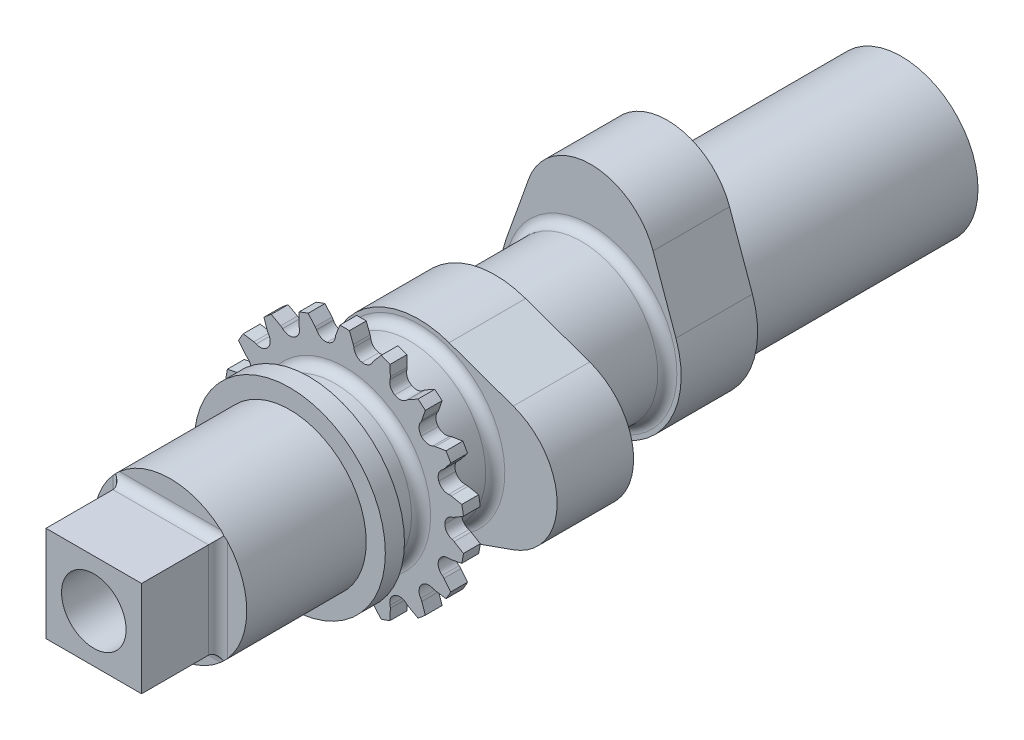
from build123d import *

# Parameters (mm, degrees)
BOSS_EXTRUDE2_DEPTH         = 12.7
BOSS_EXTRUDE3_DEPTH         = 69.85
BOSS_EXTRUDE3_DEPTH_BACK    = 51.59375
SKETCH3_R                   = 12.7
CRVPATTERN3_START           = 28.575
CRVPATTERN3_OUTLINE_R       = 12.7
CRVPATTERN3_DEPTH           = 12.7
BOSS_EXTRUDE5_START         = -31.75
BOSS_EXTRUDE5_DEPTH         = 2.794
BOSS_EXTRUDE7_START         = -19.84375
SKETCH10_R                  = 15.875
BOSS_EXTRUDE7_DEPTH         = 3.175
SKETCH9_W                   = 15.875
SKETCH9_H                   = 15.875
BOSS_EXTRUDE8_DEPTH         = 12.7
FILLET1_R                   = 1.5875
F_1_2_13_TAPPED_HOLE1_D     = 10.71626
F_1_2_13_TAPPED_HOLE1_DEPTH = 25.4
F_1_2_13_TAPPED_HOLE1_TIP   = 3.219489309


# Read off the part's stored shape, not the designer's step: CrvPattern3
with BuildPart() as part:
    # Sketch2 → Boss-Extrude2 (new body)
    with BuildSketch(Plane.XY):
        with BuildLine():
            Line((14.12854649, 5.034399247), (10.332705095, 15.687054901))
            ThreePointArc((10.332705095, 15.687054901), (0, 22.9743), (-10.332705095, 15.687054901))
            Line((-10.332705095, 15.687054901), (-14.12854649, 5.034399247))
            ThreePointArc((-14.12854649, 5.034399247), (0, -14.9987), (14.12854649, 5.034399247))
        make_face()
    extrude(amount=BOSS_EXTRUDE2_DEPTH)

    # Sketch3 → Boss-Extrude3 (add, two sides: drawn at the far end of the back side and taken through both)
    with BuildSketch(Plane.XY.offset(12.7).offset(-BOSS_EXTRUDE3_DEPTH_BACK)):
        Circle(SKETCH3_R)
    extrude(amount=BOSS_EXTRUDE3_DEPTH + BOSS_EXTRUDE3_DEPTH_BACK)

    # CrvPattern3 outline → CrvPattern3 (add)
    with BuildSketch(Plane.XY.offset(CRVPATTERN3_START)):
        with BuildLine():
            ThreePointArc((5.034399247, 14.12854649), (-14.9987, 0), (5.034399247, -14.12854649))
            Line((5.034399247, -14.12854649), (15.687054901, -10.332705095))
            ThreePointArc((15.687054901, -10.332705095), (22.9743, 0), (15.687054901, 10.332705095))
            Line((15.687054901, 10.332705095), (5.034399247, 14.12854649))
        make_face()
        Circle(CRVPATTERN3_OUTLINE_R, mode=Mode.SUBTRACT)
    extrude(amount=CRVPATTERN3_DEPTH)

    # Sketch7 → Boss-Extrude5 (add)
    with BuildSketch(Plane.XY.offset(82.55).offset(BOSS_EXTRUDE5_START)):
        with BuildLine():
            Line((-0.79375, 19.897774396), (-1.436590898, 18.231487888))
            ThreePointArc((-1.436590898, 18.231487888), (-1.498138247, 18.03477884), (-1.533681014, 17.831753627))
            ThreePointArc((-1.533681014, 17.831753627), (-1.969599997, 16.882094075), (-2.888368056, 16.384355312))
            ThreePointArc((-2.888368056, 16.384355312), (-3.922431543, 16.537748425), (-4.657630199, 17.280917099))
            ThreePointArc((-4.657630199, 17.280917099), (-4.760468189, 17.459542051), (-4.885582235, 17.623337659))
            Line((-4.885582235, 17.623337659), (-6.059558633, 18.969270258))
            ThreePointArc((-6.059558633, 18.969270258), (-6.810852326, 18.712662973), (-7.551320668, 18.426313281))
            Line((-7.551320668, 18.426313281), (-7.585489966, 16.640651609))
            ThreePointArc((-7.585489966, 16.640651609), (-7.576047099, 16.434755136), (-7.540007663, 16.231817498))
            ThreePointArc((-7.540007663, 16.231817498), (-7.624834818, 15.190336353), (-8.3179577, 14.408377726))
            ThreePointArc((-8.3179577, 14.408377726), (-9.342178022, 14.198393618), (-10.287162472, 14.64574693))
            ThreePointArc((-10.287162472, 14.64574693), (-10.444891903, 14.778426816), (-10.618482046, 14.889552815))
            Line((-10.618482046, 14.889552815), (-12.181995065, 15.752792171))
            ThreePointArc((-12.181995065, 15.752792171), (-12.800215344, 15.254702622), (-13.398090619, 14.732366841))
            Line((-13.398090619, 14.732366841), (-12.819466994, 13.042707157))
            ThreePointArc((-12.819466994, 13.042707157), (-12.74017286, 12.852457411), (-12.636898109, 12.674084624))
            ThreePointArc((-12.636898109, 12.674084624), (-12.36040203, 11.666399881), (-12.744278886, 10.694537142))
            ThreePointArc((-12.744278886, 10.694537142), (-13.63491237, 10.146912643), (-14.675911128, 10.244083533))
            ThreePointArc((-14.675911128, 10.244083533), (-14.869507504, 10.3148152), (-15.070636211, 10.359868156))
            Line((-15.070636211, 10.359868156), (-16.835103105, 10.636294862))
            ThreePointArc((-16.835103105, 10.636294862), (-17.245683481, 9.9568), (-17.628853105, 9.261479534))
            Line((-17.628853105, 9.261479534), (-16.507227108, 7.871619731))
            ThreePointArc((-16.507227108, 7.871619731), (-16.36764575, 7.71996364), (-16.209592142, 7.587670094))
            ThreePointArc((-16.209592142, 7.587670094), (-15.605122337, 6.735323405), (-15.633451952, 5.690777544))
            ThreePointArc((-15.633451952, 5.690777544), (-16.283326029, 4.871948852), (-17.294528308, 4.606832476))
            ThreePointArc((-17.294528308, 4.606832476), (-17.500641049, 4.60708464), (-17.705049229, 4.580630502))
            Line((-17.705049229, 4.580630502), (-19.457649251, 4.236903417))
            ThreePointArc((-19.457649251, 4.236903417), (-19.61106767, 3.457960351), (-19.733315733, 2.673521109))
            Line((-19.733315733, 2.673521109), (-18.203972012, 1.751098794))
            ThreePointArc((-18.203972012, 1.751098794), (-18.020939002, 1.65632832), (-17.827170135, 1.586070568))
            ThreePointArc((-17.827170135, 1.586070568), (-16.967634583, 0.991867524), (-16.636999988, 0.000626187))
            ThreePointArc((-16.636999988, 0.000626187), (-16.967258577, -0.991366685), (-17.827170135, -1.586070568))
            ThreePointArc((-17.827170135, -1.586070568), (-18.020939002, -1.65632832), (-18.203972012, -1.751098794))
            Line((-18.203972012, -1.751098794), (-19.733315733, -2.673521109))
            ThreePointArc((-19.733315733, -2.673521109), (-19.61106767, -3.457960351), (-19.457649251, -4.236903417))
            Line((-19.457649251, -4.236903417), (-17.705049229, -4.580630502))
            ThreePointArc((-17.705049229, -4.580630502), (-17.500641049, -4.60708464), (-17.294528308, -4.606832476))
            ThreePointArc((-17.294528308, -4.606832476), (-16.283599682, -4.871222219), (-15.63388029, -5.689600697))
            ThreePointArc((-15.63388029, -5.689600697), (-15.605379777, -6.734590871), (-16.209592142, -7.587670094))
            ThreePointArc((-16.209592142, -7.587670094), (-16.36764575, -7.71996364), (-16.507227108, -7.871619731))
            Line((-16.507227108, -7.871619731), (-17.628853105, -9.261479534))
            ThreePointArc((-17.628853105, -9.261479534), (-17.245683481, -9.9568), (-16.835103105, -10.636294862))
            Line((-16.835103105, -10.636294862), (-15.070636211, -10.359868156))
            ThreePointArc((-15.070636211, -10.359868156), (-14.869507504, -10.3148152), (-14.675911128, -10.244083533))
            ThreePointArc((-14.675911128, -10.244083533), (-13.63552234, -10.14677067), (-12.745083897, -10.693577767))
            ThreePointArc((-12.745083897, -10.693577767), (-12.360894486, -11.665799573), (-12.636898109, -12.674084624))
            ThreePointArc((-12.636898109, -12.674084624), (-12.74017286, -12.852457411), (-12.819466994, -13.042707157))
            Line((-12.819466994, -13.042707157), (-13.398090619, -14.732366841))
            ThreePointArc((-13.398090619, -14.732366841), (-12.800215344, -15.254702622), (-12.181995065, -15.752792171))
            Line((-12.181995065, -15.752792171), (-10.618482046, -14.889552815))
            ThreePointArc((-10.618482046, -14.889552815), (-10.444891903, -14.778426816), (-10.287162472, -14.64574693))
            ThreePointArc((-10.287162472, -14.64574693), (-9.342799764, -14.198468829), (-8.319042288, -14.407751539))
            ThreePointArc((-8.319042288, -14.407751539), (-7.625502893, -15.189940678), (-7.540007663, -16.231817498))
            ThreePointArc((-7.540007663, -16.231817498), (-7.576047099, -16.434755136), (-7.585489966, -16.640651609))
            Line((-7.585489966, -16.640651609), (-7.551320668, -18.426313281))
            ThreePointArc((-7.551320668, -18.426313281), (-6.810852326, -18.712662973), (-6.059558633, -18.969270258))
            Line((-6.059558633, -18.969270258), (-4.885582235, -17.623337659))
            ThreePointArc((-4.885582235, -17.623337659), (-4.760468189, -17.459542051), (-4.657630199, -17.280917099))
            ThreePointArc((-4.657630199, -17.280917099), (-3.923197652, -16.537622099), (-2.889601404, -16.384137839))
            ThreePointArc((-2.889601404, -16.384137839), (-1.970363111, -16.881950758), (-1.533681014, -17.831753627))
            ThreePointArc((-1.533681014, -17.831753627), (-1.498138247, -18.03477884), (-1.436590898, -18.231487888))
            Line((-1.436590898, -18.231487888), (-0.79375, -19.897774396))
            ThreePointArc((-0.79375, -19.897774396), (0, -19.9136), (0.79375, -19.897774396))
            Line((0.79375, -19.897774396), (1.436590898, -18.231487888))
            ThreePointArc((1.436590898, -18.231487888), (1.498138247, -18.03477884), (1.533681014, -17.831753627))
            ThreePointArc((1.533681014, -17.831753627), (1.969599997, -16.882094075), (2.888368056, -16.384355312))
            ThreePointArc((2.888368056, -16.384355312), (3.922431543, -16.537748425), (4.657630199, -17.280917099))
            ThreePointArc((4.657630199, -17.280917099), (4.760468189, -17.459542051), (4.885582235, -17.623337659))
            Line((4.885582235, -17.623337659), (6.059558633, -18.969270258))
            ThreePointArc((6.059558633, -18.969270258), (6.810852326, -18.712662973), (7.551320668, -18.426313281))
            Line((7.551320668, -18.426313281), (7.585489966, -16.640651609))
            ThreePointArc((7.585489966, -16.640651609), (7.576047099, -16.434755136), (7.540007663, -16.231817498))
            ThreePointArc((7.540007663, -16.231817498), (7.624834818, -15.190336353), (8.3179577, -14.408377726))
            ThreePointArc((8.3179577, -14.408377726), (9.342123063, -14.198849561), (10.287162472, -14.64574693))
            ThreePointArc((10.287162472, -14.64574693), (10.444891903, -14.778426816), (10.618482046, -14.889552815))
            Line((10.618482046, -14.889552815), (12.181995065, -15.752792171))
            ThreePointArc((12.181995065, -15.752792171), (12.800215344, -15.254702622), (13.398090619, -14.732366841))
            Line((13.398090619, -14.732366841), (12.819466994, -13.042707157))
            ThreePointArc((12.819466994, -13.042707157), (12.74017286, -12.852457411), (12.636898109, -12.674084624))
            ThreePointArc((12.636898109, -12.674084624), (12.36040203, -11.666399881), (12.744278886, -10.694537142))
            ThreePointArc((12.744278886, -10.694537142), (13.63491237, -10.146912643), (14.675911128, -10.244083533))
            ThreePointArc((14.675911128, -10.244083533), (14.869507504, -10.3148152), (15.070636211, -10.359868156))
            Line((15.070636211, -10.359868156), (16.835103105, -10.636294862))
            ThreePointArc((16.835103105, -10.636294862), (17.245683481, -9.9568), (17.628853105, -9.261479534))
            Line((17.628853105, -9.261479534), (16.507227108, -7.871619731))
            ThreePointArc((16.507227108, -7.871619731), (16.36764575, -7.71996364), (16.209592142, -7.587670094))
            ThreePointArc((16.209592142, -7.587670094), (15.605122337, -6.735323405), (15.633451952, -5.690777544))
            ThreePointArc((15.633451952, -5.690777544), (16.283075056, -4.871564252), (17.294528308, -4.606832476))
            ThreePointArc((17.294528308, -4.606832476), (17.500641049, -4.60708464), (17.705049229, -4.580630502))
            Line((17.705049229, -4.580630502), (19.457649251, -4.236903417))
            ThreePointArc((19.457649251, -4.236903417), (19.61106767, -3.457960351), (19.733315733, -2.673521109))
            Line((19.733315733, -2.673521109), (18.203972012, -1.751098794))
            ThreePointArc((18.203972012, -1.751098794), (18.020939002, -1.65632832), (17.827170135, -1.586070568))
            ThreePointArc((17.827170135, -1.586070568), (16.967634583, -0.991867524), (16.636999988, -0.000626187))
            ThreePointArc((16.636999988, -0.000626187), (16.967625956, 0.991091117), (17.827170135, 1.586070568))
            ThreePointArc((17.827170135, 1.586070568), (18.020939002, 1.65632832), (18.203972012, 1.751098794))
            Line((18.203972012, 1.751098794), (19.733315733, 2.673521109))
            ThreePointArc((19.733315733, 2.673521109), (19.61106767, 3.457960351), (19.457649251, 4.236903417))
            Line((19.457649251, 4.236903417), (17.705049229, 4.580630502))
            ThreePointArc((17.705049229, 4.580630502), (17.500641049, 4.60708464), (17.294528308, 4.606832476))
            ThreePointArc((17.294528308, 4.606832476), (16.283599682, 4.871222219), (15.63388029, 5.689600697))
            ThreePointArc((15.63388029, 5.689600697), (15.604940304, 6.734724169), (16.209592142, 7.587670094))
            ThreePointArc((16.209592142, 7.587670094), (16.36764575, 7.71996364), (16.507227108, 7.871619731))
            Line((16.507227108, 7.871619731), (17.628853105, 9.261479534))
            ThreePointArc((17.628853105, 9.261479534), (17.245683481, 9.9568), (16.835103105, 10.636294862))
            Line((16.835103105, 10.636294862), (15.070636211, 10.359868156))
            ThreePointArc((15.070636211, 10.359868156), (14.869507504, 10.3148152), (14.675911128, 10.244083533))
            ThreePointArc((14.675911128, 10.244083533), (13.63552234, 10.14677067), (12.745083897, 10.693577767))
            ThreePointArc((12.745083897, 10.693577767), (12.360435926, 11.665774524), (12.636898109, 12.674084624))
            ThreePointArc((12.636898109, 12.674084624), (12.74017286, 12.852457411), (12.819466994, 13.042707157))
            Line((12.819466994, 13.042707157), (13.398090619, 14.732366841))
            ThreePointArc((13.398090619, 14.732366841), (12.800215344, 15.254702622), (12.181995065, 15.752792171))
            Line((12.181995065, 15.752792171), (10.618482046, 14.889552815))
            ThreePointArc((10.618482046, 14.889552815), (10.444891903, 14.778426816), (10.287162472, 14.64574693))
            ThreePointArc((10.287162472, 14.64574693), (9.342799764, 14.198468829), (8.319042288, 14.407751539))
            ThreePointArc((8.319042288, 14.407751539), (7.625080555, 15.189760303), (7.540007663, 16.231817498))
            ThreePointArc((7.540007663, 16.231817498), (7.576047099, 16.434755136), (7.585489966, 16.640651609))
            Line((7.585489966, 16.640651609), (7.551320668, 18.426313281))
            ThreePointArc((7.551320668, 18.426313281), (6.810852326, 18.712662973), (6.059558633, 18.969270258))
            Line((6.059558633, 18.969270258), (4.885582235, 17.623337659))
            ThreePointArc((4.885582235, 17.623337659), (4.760468189, 17.459542051), (4.657630199, 17.280917099))
            ThreePointArc((4.657630199, 17.280917099), (3.923197652, 16.537622099), (2.889601404, 16.384137839))
            ThreePointArc((2.889601404, 16.384137839), (1.970027934, 16.881636812), (1.533681014, 17.831753627))
            ThreePointArc((1.533681014, 17.831753627), (1.498138247, 18.03477884), (1.436590898, 18.231487888))
            Line((1.436590898, 18.231487888), (0.79375, 19.897774396))
            ThreePointArc((0.79375, 19.897774396), (0, 19.9136), (-0.79375, 19.897774396))
        make_face()
    extrude(amount=BOSS_EXTRUDE5_DEPTH)

    # Sketch10 → Boss-Extrude7 (add)
    with BuildSketch(Plane.XY.offset(82.55).offset(BOSS_EXTRUDE7_START)):
        Circle(SKETCH10_R)
    extrude(amount=-BOSS_EXTRUDE7_DEPTH)

    # Sketch9 → Boss-Extrude8 (add)
    with BuildSketch(Plane.XY.offset(82.55)):
        Rectangle(SKETCH9_W, SKETCH9_H)
    extrude(amount=BOSS_EXTRUDE8_DEPTH)

    # Fillet1
    # the kernel refuses this fillet: 1.5875 mm, written as the material it adds along each edge
    with BuildSketch(Plane(origin=(0, 0, 0), x_dir=(1, 0, 0), z_dir=(0, -1, 0))) as fillet1_piece_1:
        with BuildLine():
            CenterArc((12.7 + FILLET1_R, -FILLET1_R), FILLET1_R, 90, 90)
            Line((12.7, -FILLET1_R), (12.7, 0))
            Line((12.7, 0), (12.7 + FILLET1_R, 0))
        make_face()
    revolve(axis=Axis((0, 0, 0), (0, 0, 1)))
    with BuildSketch(Plane(origin=(0, 0, 12.7), x_dir=(1, 0, 0), z_dir=(0, -1, 0))) as fillet1_piece_2:
        with BuildLine():
            CenterArc((12.7 + FILLET1_R, FILLET1_R), FILLET1_R, 180, 90)
            Line((12.7, FILLET1_R), (12.7, 0))
            Line((12.7, 0), (12.7 + FILLET1_R, 0))
        make_face()
    revolve(axis=Axis((0, 0, 12.7), (0, 0, 1)))
    with BuildSketch(Plane(origin=(0, 0, 28.575), x_dir=(1, 0, 0), z_dir=(0, -1, 0))) as fillet1_piece_3:
        with BuildLine():
            CenterArc((12.7 + FILLET1_R, -FILLET1_R), FILLET1_R, 90, 90)
            Line((12.7 + FILLET1_R, 0), (12.7, 0))
            Line((12.7, 0), (12.7, -FILLET1_R))
        make_face()
    revolve(axis=Axis((0, 0, 28.575), (0, 0, 1)))
    with BuildSketch(Plane(origin=(0, 0, 41.275), x_dir=(1, 0, 0), z_dir=(0, -1, 0))) as fillet1_piece_4:
        with BuildLine():
            CenterArc((12.7 + FILLET1_R, FILLET1_R), FILLET1_R, 180, 90)
            Line((12.7, FILLET1_R), (12.7, 0))
            Line((12.7, 0), (12.7 + FILLET1_R, 0))
        make_face()
    revolve(axis=Axis((0, 0, 41.275), (0, 0, 1)))
    with BuildSketch(Plane(origin=(0, 0, 59.53125), x_dir=(1, 0, 0), z_dir=(0, 1, 0))) as fillet1_piece_5:
        with BuildLine():
            CenterArc((12.7 + FILLET1_R, FILLET1_R), FILLET1_R, 180, 90)
            Line((12.7 + FILLET1_R, 0), (12.7, 0))
            Line((12.7, 0), (12.7, FILLET1_R))
        make_face()
    revolve(axis=Axis((0, 0, 59.53125), (0, 0, -1)))
    with BuildSketch(Plane(origin=(7.9375, 7.9375, 82.55), x_dir=(1, 0, 0), z_dir=(0, -1, 0)), Plane(origin=(-7.9375, 7.9375, 82.55), x_dir=(0, 1, 0), z_dir=(1, 0, 0)), Plane(origin=(-7.9375, -7.9375, 82.55), x_dir=(-1, 0, 0), z_dir=(0, 1, 0)), Plane(origin=(7.9375, -7.9375, 82.55), x_dir=(0, -1, 0), z_dir=(-1, 0, 0))) as fillet1_piece_6:
        with BuildLine():
            CenterArc((FILLET1_R, FILLET1_R), FILLET1_R, 180, 90)
            Line((0, FILLET1_R), (0, 0))
            Line((0, 0), (FILLET1_R, 0))
        make_face()
    extrude(amount=15.875)
    with BuildSketch(Plane(origin=(0, 0, 50.8), x_dir=(1, 0, 0), z_dir=(0, 1, 0))) as fillet1_piece_7:
        with BuildLine():
            CenterArc((12.7 + FILLET1_R, FILLET1_R), FILLET1_R, 180, 90)
            Line((12.7 + FILLET1_R, 0), (12.7, 0))
            Line((12.7, 0), (12.7, FILLET1_R))
        make_face()
    revolve(axis=Axis((0, 0, 50.8), (0, 0, -1)))
    with BuildSketch(Plane(origin=(0, 0, 53.594), x_dir=(1, 0, 0), z_dir=(0, 1, 0))) as fillet1_piece_8:
        with BuildLine():
            CenterArc((12.7 + FILLET1_R, -FILLET1_R), FILLET1_R, 90, 90)
            Line((12.7, -FILLET1_R), (12.7, 0))
            Line((12.7, 0), (12.7 + FILLET1_R, 0))
        make_face()
    revolve(axis=Axis((0, 0, 53.594), (0, 0, -1)))
    with BuildSketch(Plane(origin=(7.9375, 11.90625, 82.55), x_dir=(1, 0, 0), z_dir=(0, -1, 0))) as fillet1_piece_9a_section:
        with BuildLine():
            CenterArc((FILLET1_R, FILLET1_R), FILLET1_R, 180, 90)
            Line((0, FILLET1_R), (0, 0))
            Line((0, 0), (FILLET1_R, 0))
        make_face()
    fillet1_piece_9a = extrude(amount=19.84375, mode=Mode.PRIVATE)
    fillet1_piece_9a = fillet1_piece_9a & Plane(origin=(0, 0, 82.946165964), x_dir=(1, 0, 0), z_dir=(0, 0, -1)) * Cylinder(12.7, 47, mode=Mode.PRIVATE)
    fillet1_piece_9a = split(fillet1_piece_9a, bisect_by=Plane(origin=(8.233512557, 7.9375, 82.946165964), z_dir=(0, 1, 0)), keep=Keep.TOP, mode=Mode.PRIVATE)
    with BuildSketch(Plane(origin=(-7.9375, 7.9375, 82.55), x_dir=(0, 1, 0), z_dir=(1, 0, 0))) as fillet1_piece_9b_section:
        with BuildLine():
            CenterArc((FILLET1_R, FILLET1_R), FILLET1_R, 180, 90)
            Line((0, FILLET1_R), (0, 0))
            Line((0, 0), (FILLET1_R, 0))
        make_face()
    fillet1_piece_9b = extrude(amount=19.84375, mode=Mode.PRIVATE)
    fillet1_piece_9b = fillet1_piece_9b & Plane(origin=(0, 0, 82.946165938), x_dir=(1, 0, 0), z_dir=(0, 0, -1)) * Cylinder(12.7, 47, mode=Mode.PRIVATE)
    fillet1_piece_9b = split(fillet1_piece_9b, bisect_by=Plane(origin=(7.9375, 8.233512419, 82.946165938), z_dir=(1, 0, 0)), keep=Keep.TOP, mode=Mode.PRIVATE)
    fillet1_piece_9 = fillet1_piece_9a & fillet1_piece_9b
    add(fillet1_piece_9)
    with BuildSketch(Plane(origin=(11.90625, -7.9375, 82.55), x_dir=(0, -1, 0), z_dir=(-1, 0, 0))) as fillet1_piece_10a_section:
        with BuildLine():
            CenterArc((FILLET1_R, FILLET1_R), FILLET1_R, 180, 90)
            Line((0, FILLET1_R), (0, 0))
            Line((0, 0), (FILLET1_R, 0))
        make_face()
    fillet1_piece_10a = extrude(amount=19.84375, mode=Mode.PRIVATE)
    fillet1_piece_10a = fillet1_piece_10a & Plane(origin=(0, 0, 82.946165964), x_dir=(1, 0, 0), z_dir=(0, 0, -1)) * Cylinder(12.7, 47, mode=Mode.PRIVATE)
    fillet1_piece_10a = split(fillet1_piece_10a, bisect_by=Plane(origin=(7.9375, -8.233512557, 82.946165964), z_dir=(1, 0, 0)), keep=Keep.TOP, mode=Mode.PRIVATE)
    with BuildSketch(Plane(origin=(7.9375, 7.9375, 82.55), x_dir=(1, 0, 0), z_dir=(0, -1, 0))) as fillet1_piece_10b_section:
        with BuildLine():
            CenterArc((FILLET1_R, FILLET1_R), FILLET1_R, 180, 90)
            Line((0, FILLET1_R), (0, 0))
            Line((0, 0), (FILLET1_R, 0))
        make_face()
    fillet1_piece_10b = extrude(amount=19.84375, mode=Mode.PRIVATE)
    fillet1_piece_10b = fillet1_piece_10b & Plane(origin=(0, 0, 82.946165938), x_dir=(1, 0, 0), z_dir=(0, 0, -1)) * Cylinder(12.7, 47, mode=Mode.PRIVATE)
    fillet1_piece_10b = split(fillet1_piece_10b, bisect_by=Plane(origin=(8.233512419, -7.9375, 82.946165938), z_dir=(0, -1, 0)), keep=Keep.TOP, mode=Mode.PRIVATE)
    fillet1_piece_10 = fillet1_piece_10a & fillet1_piece_10b
    add(fillet1_piece_10)
    with BuildSketch(Plane(origin=(-7.9375, -7.9375, 82.55), x_dir=(-1, 0, 0), z_dir=(0, 1, 0))) as fillet1_piece_11a_section:
        with BuildLine():
            CenterArc((FILLET1_R, FILLET1_R), FILLET1_R, 180, 90)
            Line((0, FILLET1_R), (0, 0))
            Line((0, 0), (FILLET1_R, 0))
        make_face()
    fillet1_piece_11a = extrude(amount=19.84375, mode=Mode.PRIVATE)
    fillet1_piece_11a = fillet1_piece_11a & Plane(origin=(0, 0, 82.946165938), x_dir=(1, 0, 0), z_dir=(0, 0, -1)) * Cylinder(12.7, 47, mode=Mode.PRIVATE)
    fillet1_piece_11a = split(fillet1_piece_11a, bisect_by=Plane(origin=(-8.233512419, 7.9375, 82.946165938), z_dir=(0, 1, 0)), keep=Keep.TOP, mode=Mode.PRIVATE)
    with BuildSketch(Plane(origin=(-11.90625, 7.9375, 82.55), x_dir=(0, 1, 0), z_dir=(1, 0, 0))) as fillet1_piece_11b_section:
        with BuildLine():
            CenterArc((FILLET1_R, FILLET1_R), FILLET1_R, 180, 90)
            Line((0, FILLET1_R), (0, 0))
            Line((0, 0), (FILLET1_R, 0))
        make_face()
    fillet1_piece_11b = extrude(amount=19.84375, mode=Mode.PRIVATE)
    fillet1_piece_11b = fillet1_piece_11b & Plane(origin=(0, 0, 82.946165964), x_dir=(1, 0, 0), z_dir=(0, 0, -1)) * Cylinder(12.7, 47, mode=Mode.PRIVATE)
    fillet1_piece_11b = split(fillet1_piece_11b, bisect_by=Plane(origin=(-7.9375, 8.233512557, 82.946165964), z_dir=(-1, 0, 0)), keep=Keep.TOP, mode=Mode.PRIVATE)
    fillet1_piece_11 = fillet1_piece_11a & fillet1_piece_11b
    add(fillet1_piece_11)
    with BuildSketch(Plane(origin=(-7.9375, -11.90625, 82.55), x_dir=(-1, 0, 0), z_dir=(0, 1, 0))) as fillet1_piece_12a_section:
        with BuildLine():
            CenterArc((FILLET1_R, FILLET1_R), FILLET1_R, 180, 90)
            Line((0, FILLET1_R), (0, 0))
            Line((0, 0), (FILLET1_R, 0))
        make_face()
    fillet1_piece_12a = extrude(amount=19.84375, mode=Mode.PRIVATE)
    fillet1_piece_12a = fillet1_piece_12a & Plane(origin=(0, 0, 82.946165964), x_dir=(1, 0, 0), z_dir=(0, 0, -1)) * Cylinder(12.7, 47, mode=Mode.PRIVATE)
    fillet1_piece_12a = split(fillet1_piece_12a, bisect_by=Plane(origin=(-8.233512557, -7.9375, 82.946165964), z_dir=(0, -1, 0)), keep=Keep.TOP, mode=Mode.PRIVATE)
    with BuildSketch(Plane(origin=(7.9375, -7.9375, 82.55), x_dir=(0, -1, 0), z_dir=(-1, 0, 0))) as fillet1_piece_12b_section:
        with BuildLine():
            CenterArc((FILLET1_R, FILLET1_R), FILLET1_R, 180, 90)
            Line((0, FILLET1_R), (0, 0))
            Line((0, 0), (FILLET1_R, 0))
        make_face()
    fillet1_piece_12b = extrude(amount=19.84375, mode=Mode.PRIVATE)
    fillet1_piece_12b = fillet1_piece_12b & Plane(origin=(0, 0, 82.946165938), x_dir=(1, 0, 0), z_dir=(0, 0, -1)) * Cylinder(12.7, 47, mode=Mode.PRIVATE)
    fillet1_piece_12b = split(fillet1_piece_12b, bisect_by=Plane(origin=(-7.9375, -8.233512419, 82.946165938), z_dir=(-1, 0, 0)), keep=Keep.TOP, mode=Mode.PRIVATE)
    fillet1_piece_12 = fillet1_piece_12a & fillet1_piece_12b
    add(fillet1_piece_12)

    # 1/2-13 Tapped Hole1
    with Locations(Plane.XY.offset(95.25)):
        with Locations((0, 0)):
            Hole(F_1_2_13_TAPPED_HOLE1_D / 2, depth=F_1_2_13_TAPPED_HOLE1_DEPTH)
            with Locations((0, 0, -(F_1_2_13_TAPPED_HOLE1_DEPTH + F_1_2_13_TAPPED_HOLE1_TIP / 2))):  # 118° drill point
                Cone(0, F_1_2_13_TAPPED_HOLE1_D / 2, F_1_2_13_TAPPED_HOLE1_TIP, mode=Mode.SUBTRACT)


solid = part.part
